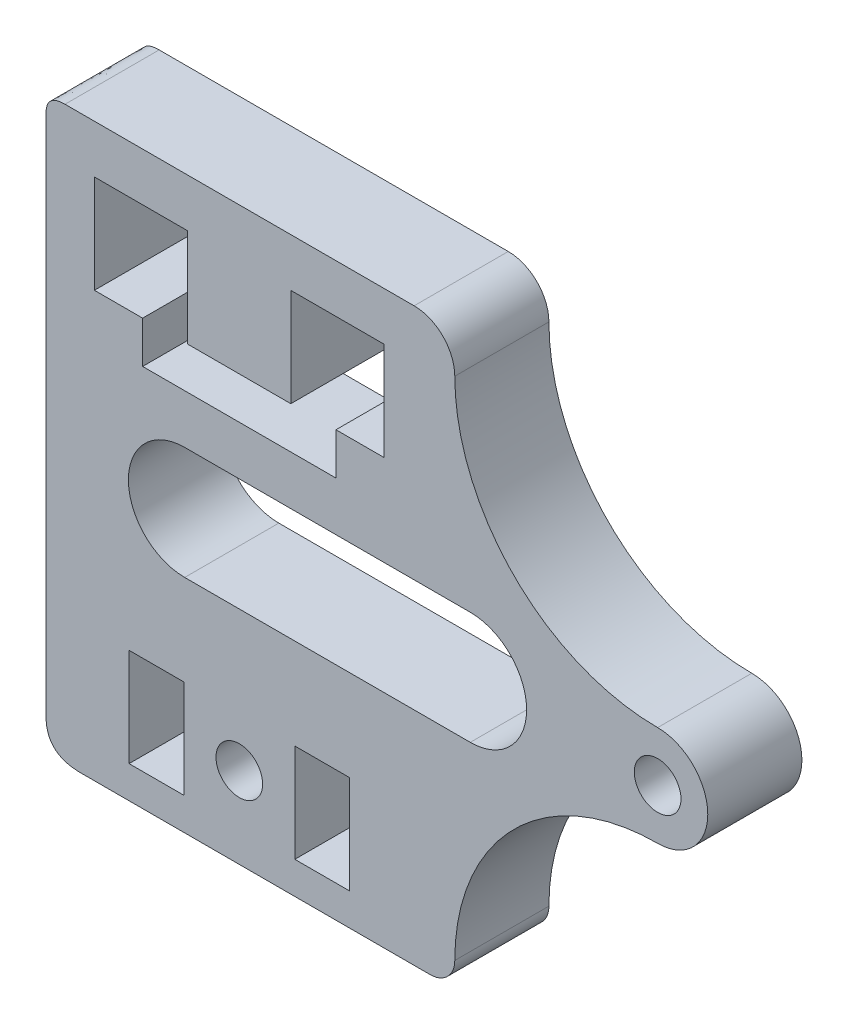
from build123d import *

# Parameters (mm, degrees)
SKETCH1_R           = 1.45
SKETCH1_W           = 3.400011
SKETCH1_H           = 6.1
BOSS_EXTRUDE2_DEPTH = 5.85


with BuildPart() as part:
    # Sketch1 → Boss-Extrude2 (new body)
    with BuildSketch(Plane.XY):
        with BuildLine():
            Line((388.728053772, 562.888903138), (410.424633118, 562.888903138))
            ThreePointArc((410.424633118, 562.888903138), (412.211329852, 562.148829119), (412.95140387, 560.362132386))
            ThreePointArc((412.95140387, 560.362132386), (416.644097047, 551.447182437), (425.559046996, 547.75448926))
            ThreePointArc((425.559046996, 547.75448926), (428.674633119, 544.638903138), (425.559046996, 541.523317015))
            ThreePointArc((425.559046996, 541.523317015), (416.644097047, 537.830623838), (412.95140387, 528.915673889))
            ThreePointArc((412.95140387, 528.915673889), (412.50422307, 527.836083937), (411.424633118, 527.388903138))
            Line((411.424633118, 527.388903138), (389.728053772, 527.388903138))
            add(Edge.make_bspline(
                [(387.555122745, 529.559612039), (387.43552985, 527.388903138), (389.728053772, 527.388903138)],
                knots=[0, 0, 0, 1, 1, 1], degree=2))
            Line((387.555122745, 529.559612039), (387.555122745, 561.717171015))
            add(Edge.make_bspline(
                [(387.555122745, 561.717171015), (387.490566794, 562.888903138), (388.728053772, 562.888903138)],
                knots=[0, 0, 0, 1, 1, 1], degree=2))
        make_face()
        with Locations((425.559046996, 544.638903138)):
            Circle(SKETCH1_R, mode=Mode.SUBTRACT)
        with Locations((399.559046996, 532.438903138)):
            Circle(SKETCH1_R, mode=Mode.SUBTRACT)
        Polygon((405.566920996, 551.188903138), (405.566920996, 553.788903138), (408.562971247, 553.788903138), (408.562971247, 559.888903138), (402.762971247, 559.888903138), (402.762971247, 553.788903138), (396.355122745, 553.788903138), (396.355122745, 559.888903138), (390.555122745, 559.888903138), (390.555122745, 553.788903138), (393.551172996, 553.788903138), (393.551172996, 551.188903138), align=None, mode=Mode.SUBTRACT)
        with Locations((394.409041496, 532.438903138)):
            Rectangle(SKETCH1_W, SKETCH1_H, mode=Mode.SUBTRACT)
        with Locations((404.709052496, 532.438903138)):
            Rectangle(SKETCH1_W, SKETCH1_H, mode=Mode.SUBTRACT)
        with BuildLine():
            Line((396.165690223, 548.138903138), (413.915690223, 548.138903138))
            ThreePointArc((413.915690223, 548.138903138), (417.415690223, 544.638903138), (413.915690223, 541.138903138))
            Line((413.915690223, 541.138903138), (396.165690223, 541.138903138))
            ThreePointArc((396.165690223, 541.138903138), (392.665690223, 544.638903138), (396.165690223, 548.138903138))
        make_face(mode=Mode.SUBTRACT)
    extrude(amount=BOSS_EXTRUDE2_DEPTH)


solid = part.part
